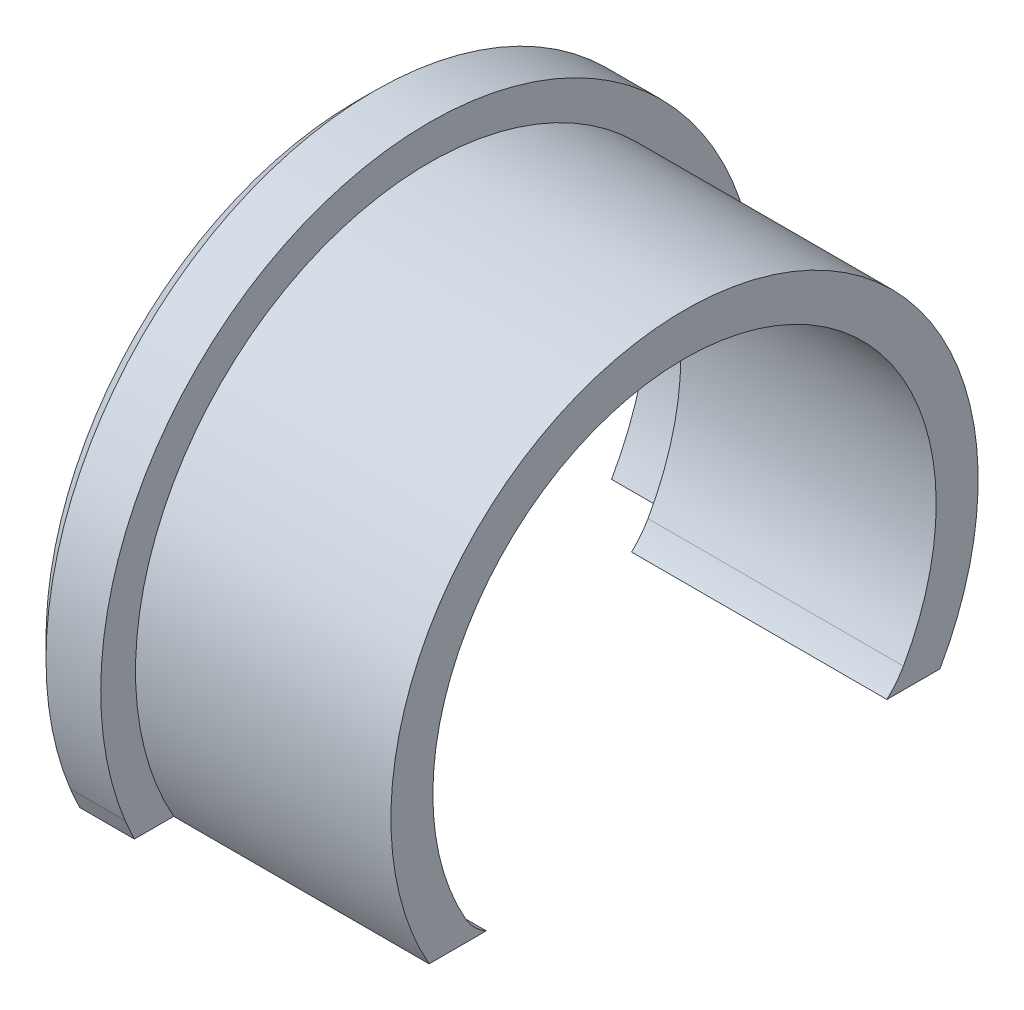
from build123d import *

# Parameters (mm, degrees)
BOSS_EXTRUDE1_DEPTH = 7
BOSS_EXTRUDE3_DEPTH = 2
CUT_EXTRUDE1_START  = -2
CUT_EXTRUDE1_DEPTH  = 2
CHAMFER1_SIZE       = 0.5


with BuildPart() as part:
    # Sketch1 → Boss-Extrude1 (new body)
    with BuildSketch(Plane(origin=(0, 0, 0), x_dir=(0, 0, -1), z_dir=(1, 0, 0))):
        with BuildLine():
            Line((0.567071197, -0.567071197), (-1, -0.567071197))
            ThreePointArc((-1, -0.567071197), (6, 11.449595469), (13, -0.567071197))
            Line((13, -0.567071197), (11.547641445, -0.567071197))
            ThreePointArc((11.547641445, -0.567071197), (11.796193723, -0.301382773), (12, 0))
            ThreePointArc((12, 0), (6, 10.3), (0, 0))
            ThreePointArc((0, 0), (0.245090031, -0.321981166), (0.567071197, -0.567071197))
        make_face()
    extrude(amount=BOSS_EXTRUDE1_DEPTH)

    # Sketch6 → Boss-Extrude3 (add)
    with BuildSketch(Plane(origin=(0, 0, 0), x_dir=(0, 0, -1), z_dir=(1, 0, 0))):
        with BuildLine():
            Line((-2.332075927, 0), (-2.077319023, -0.567071197))
            Line((-2.077319023, -0.567071197), (-1, -0.567071197))
            Line((-1, -0.567071197), (13, -0.567071197))
            Line((13, -0.567071197), (14.077319023, -0.567071197))
            Line((14.077319023, -0.567071197), (14.332075927, 0))
            ThreePointArc((14.332075927, 0), (6, 12.402427184), (-2.332075927, 0))
        make_face()
    extrude(amount=-BOSS_EXTRUDE3_DEPTH)

    # Sketch1<31> → Cut-Extrude1 (cut)
    with BuildSketch(Plane(origin=(0, 0, 0), x_dir=(0, 0, -1), z_dir=(1, 0, 0)).offset(CUT_EXTRUDE1_START)):
        with BuildLine():
            Line((0.567071197, -0.567071197), (-1, -0.567071197))
            ThreePointArc((-1, -0.567071197), (6, 11.449595469), (13, -0.567071197))
            Line((13, -0.567071197), (11.547641445, -0.567071197))
            ThreePointArc((11.547641445, -0.567071197), (11.796193723, -0.301382773), (12, 0))
            ThreePointArc((12, 0), (6, 10.3), (0, 0))
            ThreePointArc((0, 0), (0.245090031, -0.321981166), (0.567071197, -0.567071197))
        make_face()
    extrude(amount=CUT_EXTRUDE1_DEPTH, mode=Mode.SUBTRACT)


with BuildPart() as cut_extrude1_piece_1:
    # of the separate pieces the step leaves, piece 1, a body of its own (cut_extrude1_pieces_kept)
    add(part.part.solids().sort_by_distance((7, -0.567071197, 1))[0])


with BuildPart() as cut_extrude1_piece_2:
    # of the separate pieces the step leaves, piece 2, a body of its own (cut_extrude1_pieces_kept)
    add(part.part.solids().sort_by_distance((0, 0, 2.332075927))[0])

    # Chamfer1
    # the kernel refuses this chamfer: 0.5 mm, written as the material it takes off along each edge
    with BuildSketch(Plane(origin=(-2, 3.402427184, -6), x_dir=(0, -0.5063226027269031, -0.8623441435806557), z_dir=(0, -0.8623441435806557, 0.5063226027269031))) as chamfer1_piece_1:
        Polygon((9, CHAMFER1_SIZE), (9 - CHAMFER1_SIZE, 0), (9, 0), align=None)
    revolve(axis=Axis((-2, 3.402427184, -6), (1, 0, 0)), revolution_arc=240.838378196, mode=Mode.SUBTRACT)


solid = Compound([cut_extrude1_piece_1.part, cut_extrude1_piece_2.part])
